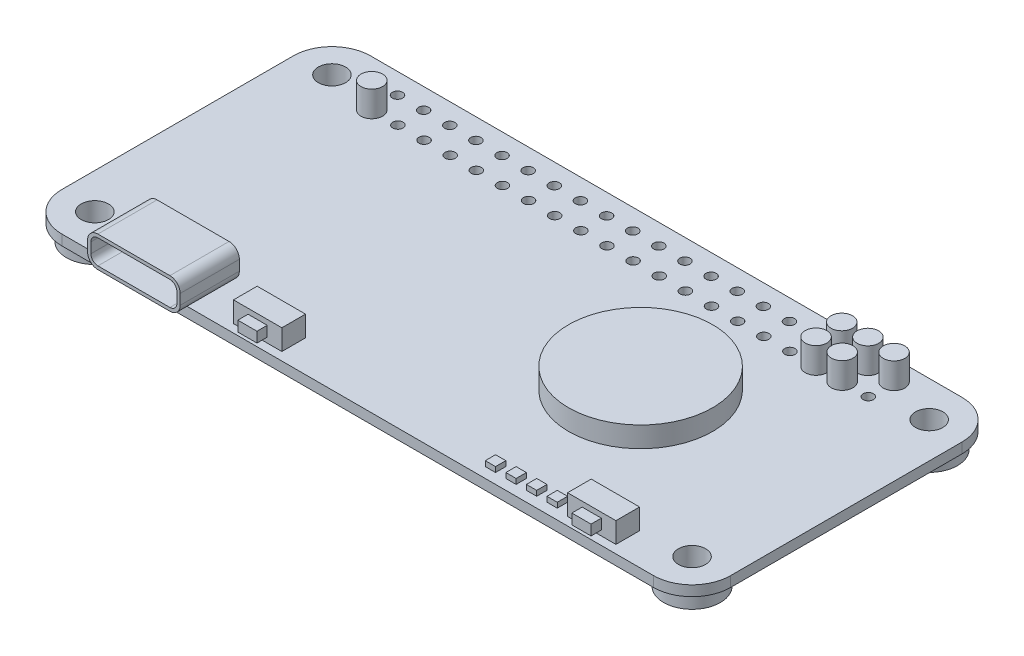
from build123d import *

# Parameters (mm, degrees)
BOSS_EXTRUDE1_DEPTH      = 1
SKETCH2_R                = 1.325
CUT_EXTRUDE1_DEPTH       = 36.80851854
SKETCH3_R                = 0.5
CUT_EXTRUDE2_DEPTH       = 36.80851854
LPATTERN1_COUNT          = 20
LPATTERN1_PITCH          = 2.54
BOSS_EXTRUDE6_DEPTH      = 1.25
BOSS_EXTRUDE6_DEPTH_BACK = 4.5
CUT_EXTRUDE9_DEPTH       = 5.25
SKETCH_1_W               = 4.7
SKETCH_1_H               = 2.3
EXTRUDE_1_DEPTH          = 2
SKETCH_2_W               = 1.86
SKETCH_2_H               = 1
EXTRUDE_2_DEPTH          = 1
SKETCH_9_R               = 2.75
SKETCH_9_R_2             = 1.325
EXTRUDE_8_DEPTH          = 1.5
SKETCH_10_R              = 1.05
EXTRUDE_9_DEPTH          = 2.5
SKETCH_11_R              = 0.5
EXTRUDE_10_DEPTH         = 3
SKETCH_12_R              = 7
EXTRUDE_11_DEPTH         = 2
SKETCH_13_W              = 1
SKETCH_13_H              = 1
EXTRUDE_12_DEPTH         = 0.5


with BuildPart() as part:
    # Sketch1 → Boss-Extrude1 (new body)
    with BuildSketch(Plane(origin=(0, 0, 0), x_dir=(1, 0, 0), z_dir=(0, 1, 0))):
        with BuildLine():
            Line((-28.75, 15), (28.75, 15))
            ThreePointArc((28.75, 15), (31.401650429, 13.901650429), (32.5, 11.25))
            Line((32.5, 11.25), (32.5, -11.25))
            ThreePointArc((32.5, -11.25), (31.401650429, -13.901650429), (28.75, -15))
            Line((28.75, -15), (-28.75, -15))
            ThreePointArc((-28.75, -15), (-31.401650429, -13.901650429), (-32.5, -11.25))
            Line((-32.5, -11.25), (-32.5, 11.25))
            ThreePointArc((-32.5, 11.25), (-31.401650429, 13.901650429), (-28.75, 15))
        make_face()
    extrude(amount=BOSS_EXTRUDE1_DEPTH)

    # Sketch2 → Cut-Extrude1 (cut, through all)
    with BuildSketch(Plane(origin=(0, 1, 0), x_dir=(1, 0, 0), z_dir=(0, 1, 0))):
        with Locations((-29.025, 11.525)):
            Circle(SKETCH2_R)
        with Locations((29.025, 11.525)):
            Circle(SKETCH2_R)
        with Locations((29.025, -11.525)):
            Circle(SKETCH2_R)
        with Locations((-29.025, -11.525)):
            Circle(SKETCH2_R)
    extrude(amount=-CUT_EXTRUDE1_DEPTH, mode=Mode.SUBTRACT)

    # Sketch3 → Cut-Extrude2 (cut, through all)
    with BuildSketch(Plane(origin=(0, 1, 0), x_dir=(1, 0, 0), z_dir=(0, 1, 0))):
        with Locations((-24.128, 13)):
            Circle(SKETCH3_R)
        with Locations((-24.128, 10.5)):
            Circle(SKETCH3_R)
    cut_extrude2 = extrude(amount=-CUT_EXTRUDE2_DEPTH, mode=Mode.SUBTRACT)

    # LPattern1: Cut-Extrude2 ×20
    with Locations(*[(i * LPATTERN1_PITCH, 0, 0) for i in range(1, LPATTERN1_COUNT)]):
        add(cut_extrude2, mode=Mode.SUBTRACT)

    # Sketch15 → Boss-Extrude6 (add, two sides: drawn at the far end of the back side and taken through both)
    with BuildSketch(Plane.XY.offset(15).offset(-BOSS_EXTRUDE6_DEPTH_BACK)):
        with BuildLine():
            Line((-24, 4), (-17, 4))
            ThreePointArc((-17, 4), (-16.292893219, 3.707106781), (-16, 3))
            Line((-16, 3), (-16, 2))
            ThreePointArc((-16, 2), (-16.292893219, 1.292893219), (-17, 1))
            Line((-17, 1), (-24, 1))
            ThreePointArc((-24, 1), (-24.707106781, 1.292893219), (-25, 2))
            Line((-25, 2), (-25, 3))
            ThreePointArc((-25, 3), (-24.707106781, 3.707106781), (-24, 4))
        make_face()
    extrude(amount=BOSS_EXTRUDE6_DEPTH + BOSS_EXTRUDE6_DEPTH_BACK)

    # Sketch16 → Cut-Extrude9 (cut)
    with BuildSketch(Plane.XY.offset(16.25)):
        with BuildLine():
            Line((-17, 3.68), (-24, 3.68))
            ThreePointArc((-24, 3.68), (-24.480832611, 3.480832611), (-24.68, 3))
            Line((-24.68, 3), (-24.68, 2))
            ThreePointArc((-24.68, 2), (-24.480832611, 1.519167389), (-24, 1.32))
            Line((-24, 1.32), (-17, 1.32))
            ThreePointArc((-17, 1.32), (-16.519167389, 1.519167389), (-16.32, 2))
            Line((-16.32, 2), (-16.32, 3))
            ThreePointArc((-16.32, 3), (-16.519167389, 3.480832611), (-17, 3.68))
        make_face()
    extrude(amount=-CUT_EXTRUDE9_DEPTH, mode=Mode.SUBTRACT)

    # 草图1 → 凸台-拉伸1 (add)
    with BuildSketch(Plane(origin=(0, 1, 0), x_dir=(1, 0, 0), z_dir=(0, 1, 0))):
        with Locations((-10.52, -13.05)):
            Rectangle(SKETCH_1_W, SKETCH_1_H)
        with Locations((21.95, -13.05)):
            Rectangle(SKETCH_1_W, SKETCH_1_H)
    extrude(amount=EXTRUDE_1_DEPTH)

    # 草图2 → 凸台-拉伸2 (add)
    with BuildSketch(Plane.XY.offset(14.2)):
        with Locations((-10.52, 2)):
            Rectangle(SKETCH_2_W, SKETCH_2_H)
        with Locations((21.95, 2)):
            Rectangle(SKETCH_2_W, SKETCH_2_H)
    extrude(amount=EXTRUDE_2_DEPTH)

    # 草图9 → 凸台-拉伸8 (add)
    # profile 1 of 4: a face of its own
    with BuildSketch(Plane.XZ):
        with Locations((29.025, 11.525)):
            Circle(SKETCH_9_R)
        with Locations((29.025, 11.525)):
            Circle(SKETCH_9_R_2, mode=Mode.SUBTRACT)
    # profile 2 of 4: a face of its own
    with BuildSketch(Plane.XZ):
        with Locations((29.025, -11.525)):
            Circle(SKETCH_9_R)
        with Locations((29.025, -11.525)):
            Circle(SKETCH_9_R_2, mode=Mode.SUBTRACT)
    # profile 3 of 4: a face of its own
    with BuildSketch(Plane.XZ):
        with Locations((-29.025, 11.525)):
            Circle(SKETCH_9_R)
        with Locations((-29.025, 11.525)):
            Circle(SKETCH_9_R_2, mode=Mode.SUBTRACT)
    # profile 4 of 4: a face of its own
    with BuildSketch(Plane.XZ):
        with Locations((-29.025, -11.525)):
            Circle(SKETCH_9_R)
        with Locations((-29.025, -11.525)):
            Circle(SKETCH_9_R_2, mode=Mode.SUBTRACT)
    extrude(amount=EXTRUDE_8_DEPTH)

    # 草图10 → 凸台-拉伸9 (add)
    with BuildSketch(Plane(origin=(0, 1, 0), x_dir=(1, 0, 0), z_dir=(0, 1, 0))):
        with Locations((24.132, 13)):
            Circle(SKETCH_10_R)
        with Locations((21.592, 13)):
            Circle(SKETCH_10_R)
        with Locations((19.052, 13)):
            Circle(SKETCH_10_R)
        with Locations((21.592, 10.5)):
            Circle(SKETCH_10_R)
        with Locations((19.052, 10.5)):
            Circle(SKETCH_10_R)
        with Locations((-24.128, 10.5)):
            Circle(SKETCH_10_R)
    extrude(amount=EXTRUDE_9_DEPTH)

    # 草图11 → 凸台-拉伸10 (add)
    with BuildSketch(Plane.XZ.offset(-1)):
        with Locations((24.132, -13)):
            Circle(SKETCH_11_R)
        with Locations((21.592, -13)):
            Circle(SKETCH_11_R)
        with Locations((21.592, -10.5)):
            Circle(SKETCH_11_R)
        with Locations((19.052, -10.5)):
            Circle(SKETCH_11_R)
        with Locations((19.052, -13)):
            Circle(SKETCH_11_R)
        with Locations((-24.128, -10.5)):
            Circle(SKETCH_11_R)
    extrude(amount=EXTRUDE_10_DEPTH)

    # 草图12 → 凸台-拉伸11 (add)
    with BuildSketch(Plane(origin=(0, 1, 0), x_dir=(1, 0, 0), z_dir=(0, 1, 0))):
        with Locations((12.5, 0)):
            Circle(SKETCH_12_R)
    extrude(amount=EXTRUDE_11_DEPTH)

    # 草图13 → 凸台-拉伸12 (add)
    with BuildSketch(Plane(origin=(0, 1, 0), x_dir=(1, 0, 0), z_dir=(0, 1, 0))):
        with Locations((17.9, -13.5)):
            Rectangle(SKETCH_13_W, SKETCH_13_H)
        with Locations((15.9, -13.5)):
            Rectangle(SKETCH_13_W, SKETCH_13_H)
        with Locations((13.9, -13.5)):
            Rectangle(SKETCH_13_W, SKETCH_13_H)
        with Locations((11.9, -13.5)):
            Rectangle(SKETCH_13_W, SKETCH_13_H)
    extrude(amount=EXTRUDE_12_DEPTH)


solid = part.part
